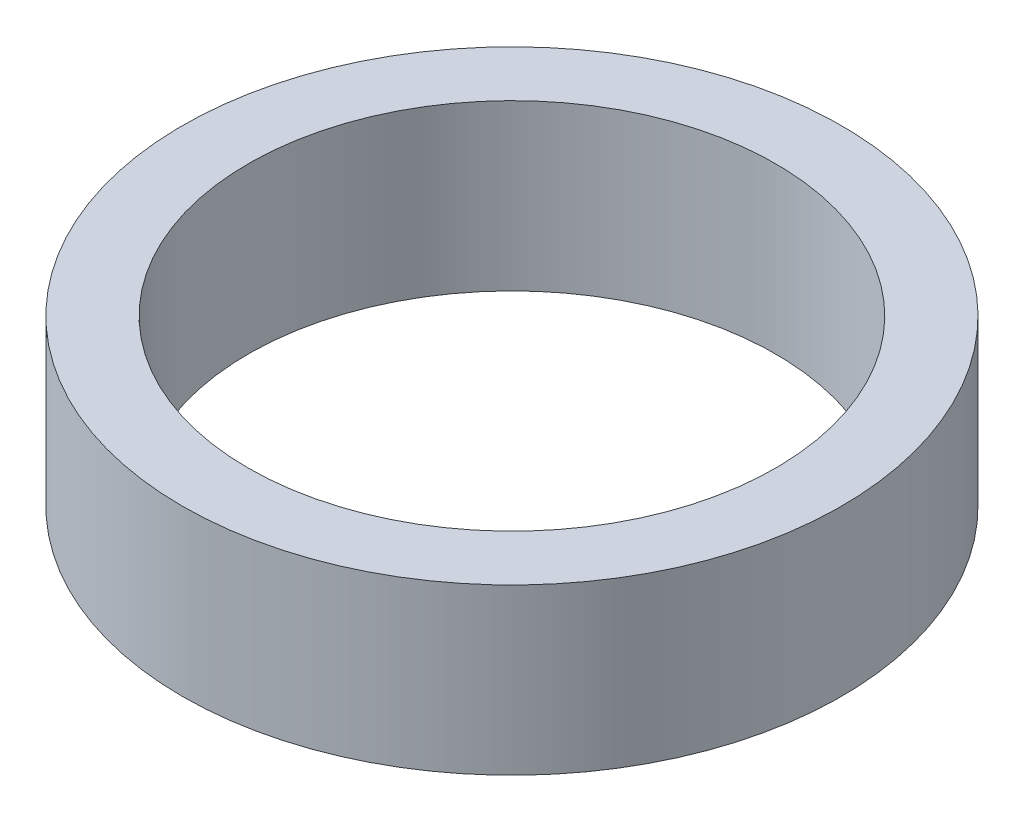
from build123d import *

# Parameters (mm, degrees)
SKETCH1_R           = 50
BOSS_EXTRUDE1_DEPTH = 25
SKETCH2_R           = 40
CUT_EXTRUDE1_DEPTH  = 76


with BuildPart() as part:
    # Sketch1 → Boss-Extrude1 (new body)
    with BuildSketch(Plane(origin=(0, 0, 0), x_dir=(1, 0, 0), z_dir=(0, 1, 0))):
        Circle(SKETCH1_R)
    extrude(amount=BOSS_EXTRUDE1_DEPTH)

    # Sketch2 → Cut-Extrude1 (cut, through all)
    with BuildSketch(Plane(origin=(0, 0, 0), x_dir=(1, 0, 0), z_dir=(0, 1, 0))):
        Circle(SKETCH2_R)
    extrude(amount=CUT_EXTRUDE1_DEPTH, mode=Mode.SUBTRACT)


solid = part.part
